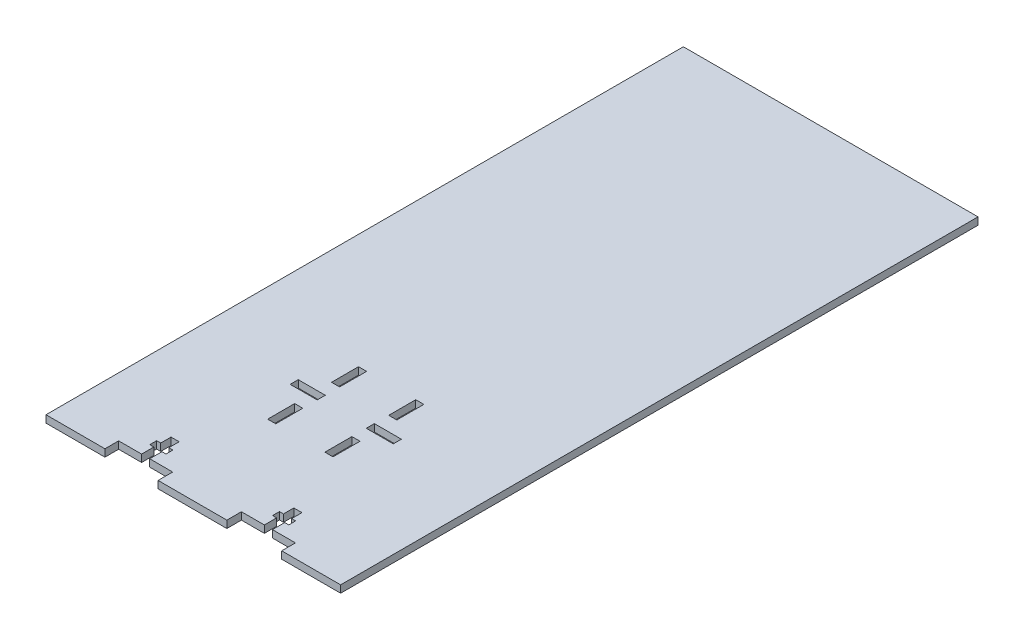
from build123d import *

# Parameters (mm, degrees)
SKETCH1_W           = 120
SKETCH1_H           = 254
BOSS_EXTRUDE1_DEPTH = 2.9718
SKETCH2_W           = 3.302
SKETCH2_H           = 24
CUT_EXTRUDE1_DEPTH  = 141.491393314
SKETCH3_W           = 6.604
SKETCH3_H           = 2.794
CUT_EXTRUDE2_DEPTH  = 141.491393314
SKETCH4_W           = 24
SKETCH4_H           = 5.588
BOSS_EXTRUDE2_DEPTH = 2.9718
SKETCH5_W           = 28
SKETCH5_H           = 5.93221154
BOSS_EXTRUDE3_DEPTH = 2.9718
SKETCH6_W           = 11
SKETCH6_H           = 3.302
SKETCH6_W_2         = 3.302
SKETCH6_H_2         = 11
CUT_EXTRUDE3_DEPTH  = 146.875990005


with BuildPart() as part:
    # Sketch1 → Boss-Extrude1 (new body)
    with BuildSketch(Plane(origin=(0, 0, 0), x_dir=(1, 0, 0), z_dir=(0, 1, 0))):
        Rectangle(SKETCH1_W, SKETCH1_H)
    extrude(amount=BOSS_EXTRUDE1_DEPTH)

    # Sketch2 → Cut-Extrude1 (cut, through all)
    with BuildSketch(Plane(origin=(0, 2.9718, 0), x_dir=(1, 0, 0), z_dir=(0, 1, 0))):
        with Locations((-25, -127)):
            Rectangle(SKETCH2_W, SKETCH2_H)
        with Locations((25, -127)):
            Rectangle(SKETCH2_W, SKETCH2_H)
    extrude(amount=-CUT_EXTRUDE1_DEPTH, mode=Mode.SUBTRACT)

    # Sketch3 → Cut-Extrude2 (cut, through all)
    with BuildSketch(Plane(origin=(0, 2.9718, 0), x_dir=(1, 0, 0), z_dir=(0, 1, 0))):
        with Locations((-25, -120.603)):
            Rectangle(SKETCH3_W, SKETCH3_H)
        with Locations((25, -120.603)):
            Rectangle(SKETCH3_W, SKETCH3_H)
    extrude(amount=-CUT_EXTRUDE2_DEPTH, mode=Mode.SUBTRACT)

    # Sketch4 → Boss-Extrude2 (add)
    with BuildSketch(Plane(origin=(0, 2.9718, 0), x_dir=(1, 0, 0), z_dir=(0, 1, 0))):
        with Locations((48, -129.794)):
            Rectangle(SKETCH4_W, SKETCH4_H)
        with Locations((-48, -129.794)):
            Rectangle(SKETCH4_W, SKETCH4_H)
    extrude(amount=-BOSS_EXTRUDE2_DEPTH)

    # Sketch5 → Boss-Extrude3 (add)
    with BuildSketch(Plane(origin=(0, 2.9718, 0), x_dir=(1, 0, 0), z_dir=(0, 1, 0))):
        with Locations((0, -129.96610577)):
            Rectangle(SKETCH5_W, SKETCH5_H)
    extrude(amount=-BOSS_EXTRUDE3_DEPTH)

    # Sketch6 → Cut-Extrude3 (cut, through all)
    with BuildSketch(Plane(origin=(0, 2.9718, 0), x_dir=(1, 0, 0), z_dir=(0, 1, 0))):
        with Locations((-15.5, -70.5)):
            Rectangle(SKETCH6_W, SKETCH6_H)
        with Locations((-11.651, -57.5)):
            Rectangle(SKETCH6_W_2, SKETCH6_H_2)
        with Locations((-11.651, -83.5)):
            Rectangle(SKETCH6_W_2, SKETCH6_H_2)
        with Locations((11.651, -83.5)):
            Rectangle(SKETCH6_W_2, SKETCH6_H_2)
        with Locations((15.5, -70.5)):
            Rectangle(SKETCH6_W, SKETCH6_H)
        with Locations((11.651, -57.5)):
            Rectangle(SKETCH6_W_2, SKETCH6_H_2)
    extrude(amount=-CUT_EXTRUDE3_DEPTH, mode=Mode.SUBTRACT)


solid = part.part
